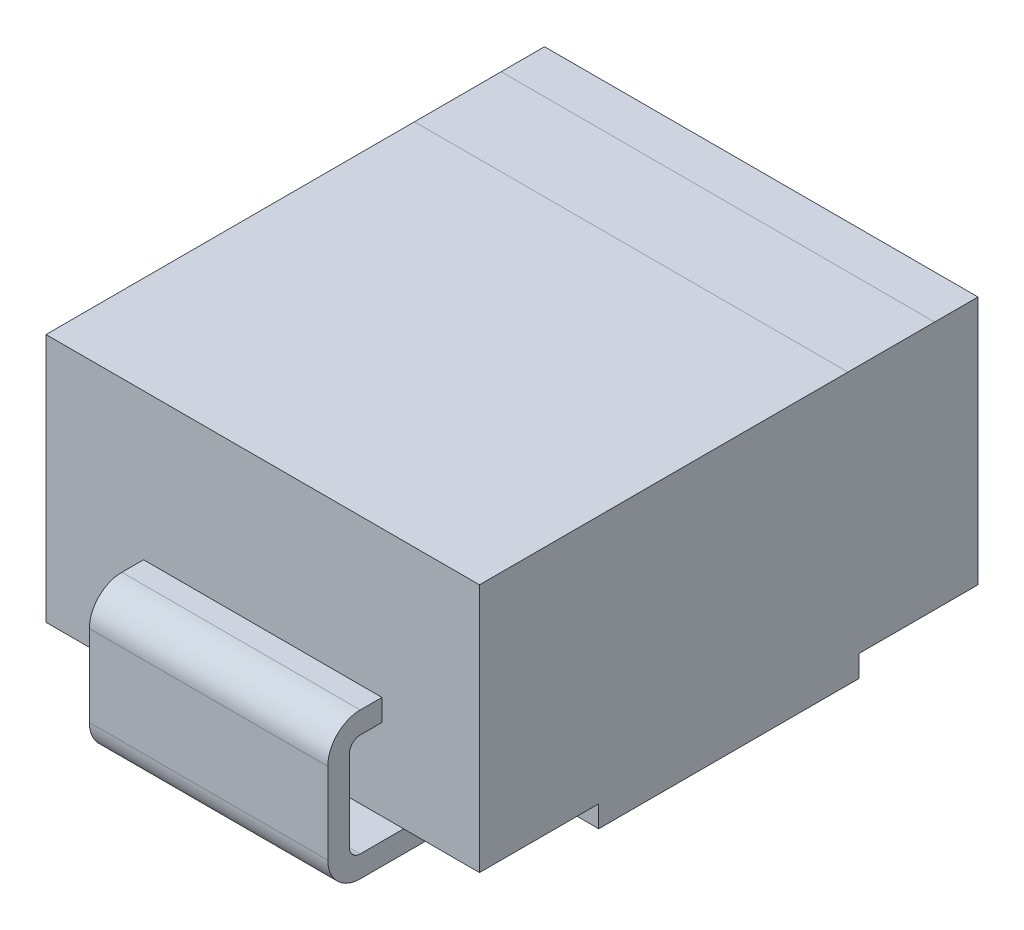
from build123d import *

# Parameters (mm, degrees)
BODY_DEPTH = 2
PIN1_DEPTH = 1.1


with BuildPart() as part:
    # Эскиз1 → Body (new, symmetric)
    with BuildSketch(Plane(origin=(0, 0, 0), x_dir=(0, 0, -1), z_dir=(1, 0, 0))):
        Polygon((-2.3, 2.7), (2.3, 2.7), (2.3, 0.4), (1.2, 0.4), (1.2, 0.2), (-1.2, 0.2), (-1.2, 0.4), (-2.3, 0.4), align=None)
    extrude(amount=BODY_DEPTH, both=True)


with BuildPart() as body_2:
    # Эскиз3 → Pin1 (new, symmetric)
    with BuildSketch(Plane(origin=(0, 0, 0), x_dir=(0, 0, -1), z_dir=(1, 0, 0))):
        with BuildLine():
            Line((2.3, 1.35), (2.5, 1.35))
            ThreePointArc((2.5, 1.35), (2.712132034, 1.262132034), (2.8, 1.05))
            Line((2.8, 1.05), (2.8, 0.3))
            ThreePointArc((2.8, 0.3), (2.712132034, 0.087867966), (2.5, 0))
            Line((2.5, 0), (1.3, 0))
            Line((1.3, 0), (1.3, 0.2))
            Line((1.3, 0.2), (2.5, 0.2))
            ThreePointArc((2.5, 0.2), (2.570710678, 0.229289322), (2.6, 0.3))
            Line((2.6, 0.3), (2.6, 1.05))
            ThreePointArc((2.6, 1.05), (2.570710678, 1.120710678), (2.5, 1.15))
            Line((2.5, 1.15), (2.3, 1.15))
            Line((2.3, 1.15), (2.3, 1.35))
        make_face()
    extrude(amount=PIN1_DEPTH, both=True)


with BuildPart() as body_3:
    # Зеркальное отражение4: mirrored copy
    add(body_2.part.mirror(Plane.XY))


solid = Compound([part.part, body_2.part, body_3.part])
